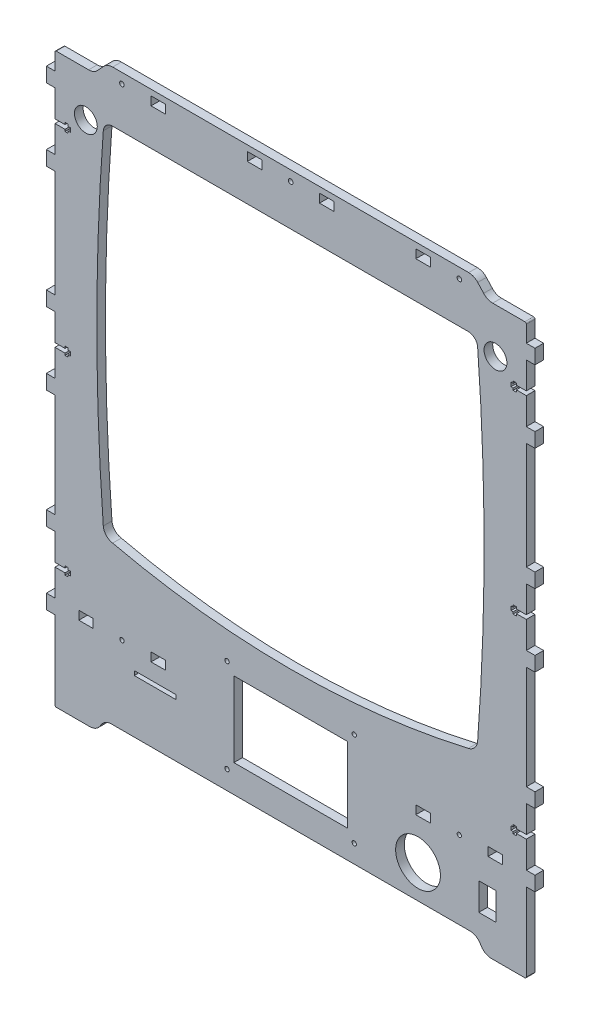
from build123d import *

# Parameters (mm, degrees)
SKETCH_1_R      = 1.5
SKETCH_1_R_2    = 15.5
SKETCH_1_R_3    = 1.6
SKETCH_1_R_4    = 7.9
SKETCH_1_W      = 10
SKETCH_1_H      = 6
SKETCH_1_W_2    = 78.6
SKETCH_1_H_2    = 51.99959895
SKETCH_1_W_3    = 12
SKETCH_1_H_3    = 19
SKETCH_1_W_4    = 29
SKETCH_1_H_4    = 3
EXTRUDE_2_DEPTH = 6


with BuildPart() as part:
    # Эскиз1 → Бобышка-Вытянуть2 (new body)
    with BuildSketch(Plane.XY):
        with BuildLine():
            Line((-162.349245127, -146.930877786), (-168.354558228, -146.930877786))
            Line((-168.354558228, -146.930877786), (-168.354558228, -136.930877786))
            Line((-168.354558228, -136.930877786), (-162.354558228, -136.930877786))
            Line((-162.354558228, -136.930877786), (-162.354558228, -118.320877786))
            Line((-162.354558228, -118.320877786), (-155.442615928, -118.320877786))
            Line((-155.442615928, -118.320877786), (-155.442615928, -119.72098181))
            Line((-155.442615928, -119.72098181), (-153.241793345, -119.72098181))
            Line((-153.241793345, -119.72098181), (-153.241793345, -118.321100605))
            Line((-153.241793345, -118.321100605), (-151.743644127, -118.321100605))
            Line((-151.743644127, -118.321100605), (-151.743644127, -115.521795283))
            Line((-151.743644127, -115.521795283), (-153.245115684, -115.521795283))
            Line((-153.245115684, -115.521795283), (-153.245115684, -114.120877786))
            Line((-153.245115684, -114.120877786), (-155.445116095, -114.120877786))
            Line((-155.445116095, -114.120877786), (-155.445116095, -115.520877786))
            Line((-155.445116095, -115.520877786), (-162.354558228, -115.520877786))
            Line((-162.354558228, -115.520877786), (-162.354558228, -96.940877786))
            Line((-162.354558228, -96.940877786), (-168.354558228, -96.940877786))
            Line((-168.354558228, -96.940877786), (-168.354558228, -86.940877786))
            Line((-168.354558228, -86.940877786), (-162.354558228, -86.940877786))
            Line((-162.354558228, -86.940877786), (-162.354558228, -15.210877786))
            Line((-162.354558228, -15.210877786), (-168.354558228, -15.210877786))
            Line((-168.354558228, -15.210877786), (-168.354558228, -5.210877786))
            Line((-168.354558228, -5.210877786), (-162.354558228, -5.210877786))
            Line((-162.354558228, -5.210877786), (-162.354558228, 13.389122214))
            Line((-162.354558228, 13.389122214), (-155.444055652, 13.389122214))
            Line((-155.444055652, 13.389122214), (-155.444055652, 11.989017706))
            Line((-155.444055652, 11.989017706), (-153.243233069, 11.989017706))
            Line((-153.243233069, 11.989017706), (-153.243233069, 13.362239479))
            Line((-153.243233069, 13.362239479), (-151.742761748, 13.362239479))
            Line((-151.742761748, 13.362239479), (-151.742761748, 16.188530845))
            Line((-151.742761748, 16.188530845), (-153.245115684, 16.188530845))
            Line((-153.245115684, 16.188530845), (-153.245115684, 17.589122214))
            Line((-153.245115684, 17.589122214), (-155.445116095, 17.589122214))
            Line((-155.445116095, 17.589122214), (-155.445116095, 16.189122214))
            Line((-155.445116095, 16.189122214), (-162.354558228, 16.189122214))
            Line((-162.354558228, 16.189122214), (-162.354558228, 34.789122214))
            Line((-162.354558228, 34.789122214), (-168.354558228, 34.789122214))
            Line((-168.354558228, 34.789122214), (-168.354558228, 44.789122214))
            Line((-168.354558228, 44.789122214), (-162.354558228, 44.789122214))
            Line((-162.354558228, 44.789122214), (-162.354558228, 118.949122214))
            Line((-162.354558228, 118.949122214), (-168.354558228, 118.949122214))
            Line((-168.354558228, 118.949122214), (-168.354558228, 128.949122214))
            Line((-168.354558228, 128.949122214), (-162.354558228, 128.949122214))
            Line((-162.354558228, 128.949122214), (-162.354558228, 147.549122214))
            Line((-162.354558228, 147.549122214), (-155.444087484, 147.549122214))
            Line((-155.444087484, 147.549122214), (-155.444087484, 146.149017702))
            Line((-155.444087484, 146.149017702), (-153.243264902, 146.149017702))
            Line((-153.243264902, 146.149017702), (-153.243264902, 147.548898907))
            Line((-153.243264902, 147.548898907), (-151.737469071, 147.548898907))
            Line((-151.737469071, 147.548898907), (-151.737951164, 150.348204717))
            Line((-151.737951164, 150.348204717), (-153.239802583, 150.348204717))
            Line((-153.239802583, 150.348204717), (-153.239802583, 151.749122214))
            Line((-153.239802583, 151.749122214), (-155.439802995, 151.749122214))
            Line((-155.439802995, 151.749122214), (-155.439802995, 150.349122214))
            Line((-155.439802995, 150.349122214), (-162.349245127, 150.349122214))
            Line((-162.349245127, 150.349122214), (-162.349245127, 168.949122214))
            Line((-162.349245127, 168.949122214), (-168.349245127, 168.949122214))
            Line((-168.349245127, 168.949122214), (-168.349245127, 178.949122214))
            Line((-168.349245127, 178.949122214), (-162.349245127, 178.949122214))
            Line((-162.349245127, 178.949122214), (-162.349245127, 190.349122214))
            ThreePointArc((-162.349245127, 190.349122214), (-162.144381362, 191.019766001), (-161.525304034, 191.349122214))
            Line((-161.525304034, 191.349122214), (-139.092392644, 191.349122214))
            ThreePointArc((-139.092392644, 191.349122214), (-135.666701236, 192.070006687), (-132.82207518, 194.110383773))
            Line((-132.82207518, 194.110383773), (-128.724185584, 198.587860655))
            ThreePointArc((-128.724185584, 198.587860655), (-125.879559527, 200.62823774), (-122.453868119, 201.349122214))
            Line((-122.453868119, 201.349122214), (123.955377865, 201.349122214))
            ThreePointArc((123.955377865, 201.349122214), (127.381069274, 200.62823774), (130.22569533, 198.587860655))
            Line((130.22569533, 198.587860655), (134.323584926, 194.110383773))
            ThreePointArc((134.323584926, 194.110383773), (137.168210982, 192.070006687), (140.59390239, 191.349122214))
            Line((140.59390239, 191.349122214), (162.850754873, 191.349122214))
            ThreePointArc((162.850754873, 191.349122214), (163.557861654, 191.056228995), (163.850754873, 190.349122214))
            Line((163.850754873, 190.349122214), (163.850754873, 178.949122214))
            Line((163.850754873, 178.949122214), (169.850754873, 178.949122214))
            Line((169.850754873, 178.949122214), (169.850754873, 168.949122214))
            Line((169.850754873, 168.949122214), (163.850754873, 168.949122214))
            Line((163.850754873, 168.949122214), (163.850754873, 150.349122214))
            Line((163.850754873, 150.349122214), (156.938753666, 150.349122214))
            Line((156.938753666, 150.349122214), (156.938753666, 151.74917383))
            Line((156.938753666, 151.74917383), (154.741012446, 151.74917383))
            Line((154.741012446, 151.74917383), (154.741012446, 150.349292624))
            Line((154.741012446, 150.349292624), (153.241012446, 150.349292624))
            Line((153.241012446, 150.349292624), (153.241012446, 147.550209336))
            Line((153.241012446, 147.550209336), (154.741012446, 147.550209336))
            Line((154.741012446, 147.550209336), (154.741012446, 146.149291839))
            Line((154.741012446, 146.149291839), (156.941736218, 146.149291839))
            Line((156.941736218, 146.149291839), (156.941736218, 147.549122214))
            Line((156.941736218, 147.549122214), (163.851237257, 147.549122214))
            Line((163.851237257, 147.549122214), (163.851237257, 128.949122214))
            Line((163.851237257, 128.949122214), (169.851237081, 128.949122214))
            Line((169.851237081, 128.949122214), (169.851237081, 118.949122214))
            Line((169.851237081, 118.949122214), (163.851237081, 118.949122214))
            Line((163.851237081, 118.949122214), (163.851237081, 44.789122214))
            Line((163.851237081, 44.789122214), (169.851237081, 44.789122214))
            Line((169.851237081, 44.789122214), (169.851237081, 34.789122214))
            Line((169.851237081, 34.789122214), (163.851237081, 34.789122214))
            Line((163.851237081, 34.789122214), (163.851237081, 16.189122214))
            Line((163.851237081, 16.189122214), (156.939202586, 16.189122214))
            Line((156.939202586, 16.189122214), (156.939202586, 17.562103605))
            Line((156.939202586, 17.562103605), (154.739101533, 17.562103605))
            Line((154.739101533, 17.562103605), (154.739101533, 16.189291862))
            Line((154.739101533, 16.189291862), (153.239956889, 16.189291862))
            Line((153.239956889, 16.189291862), (153.239956889, 13.39020884))
            Line((153.239956889, 13.39020884), (154.741461365, 13.39020884))
            Line((154.741461365, 13.39020884), (154.741461365, 11.989291851))
            Line((154.741461365, 11.989291851), (156.941702753, 11.989291851))
            Line((156.941702753, 11.989291851), (156.941702753, 13.389122214))
            Line((156.941702753, 13.389122214), (163.851237081, 13.389122214))
            Line((163.851237081, 13.389122214), (163.851237081, -5.210877786))
            Line((163.851237081, -5.210877786), (169.851237081, -5.210877786))
            Line((169.851237081, -5.210877786), (169.851237081, -15.210877786))
            Line((169.851237081, -15.210877786), (163.851237081, -15.210877786))
            Line((163.851237081, -15.210877786), (163.851237081, -86.940877786))
            Line((163.851237081, -86.940877786), (169.851237081, -86.940877786))
            Line((169.851237081, -86.940877786), (169.851237081, -96.940877786))
            Line((169.851237081, -96.940877786), (163.939237081, -96.940877786))
            Line((163.939237081, -96.940877786), (163.939237081, -115.520877786))
            Line((163.939237081, -115.520877786), (156.93923577, -115.520877786))
            Line((156.93923577, -115.520877786), (156.93923577, -114.122358317))
            Line((156.93923577, -114.122358317), (154.738205666, -114.122358317))
            Line((154.738205666, -114.122358317), (154.738205666, -115.522239523))
            Line((154.738205666, -115.522239523), (153.238413576, -115.522239523))
            Line((153.238413576, -115.522239523), (153.238413576, -118.322187164))
            Line((153.238413576, -118.322187164), (154.740539372, -118.322187164))
            Line((154.740539372, -118.322187164), (154.740539372, -119.723103854))
            Line((154.740539372, -119.723103854), (156.939923762, -119.723103854))
            Line((156.939923762, -119.723103854), (156.939923762, -118.320877786))
            Line((156.939923762, -118.320877786), (163.851344603, -118.320877786))
            Line((163.851344603, -118.320877786), (163.851344603, -136.930877786))
            Line((163.851344603, -136.930877786), (169.845441772, -136.930877786))
            Line((169.845441772, -136.930877786), (169.845441772, -146.930877786))
            Line((169.845441772, -146.930877786), (163.845441772, -146.930877786))
            Line((163.845441772, -146.930877786), (163.845441772, -200.973061911))
            ThreePointArc((163.845441772, -200.973061911), (163.501928515, -201.680136073), (162.762754873, -201.947675896))
            Line((162.762754873, -201.947675896), (139.726369967, -201.947675896))
            ThreePointArc((139.726369967, -201.947675896), (136.178541077, -201.14298723), (133.302992201, -198.914572468))
            Line((133.302992201, -198.914572468), (131.246288055, -195.894919373))
            ThreePointArc((131.246288055, -195.894919373), (128.327165513, -193.654997866), (124.734910288, -192.858614055))
            Line((124.734910288, -192.858614055), (-123.233400542, -192.858614055))
            ThreePointArc((-123.233400542, -192.858614055), (-126.825655767, -193.654997866), (-129.744778309, -195.894919373))
            Line((-129.744778309, -195.894919373), (-131.801482455, -198.914572469))
            ThreePointArc((-131.801482455, -198.914572469), (-134.720604996, -201.154493976), (-138.312860221, -201.950877786))
            Line((-138.312860221, -201.950877786), (-161.437304034, -201.950877786))
            ThreePointArc((-161.437304034, -201.950877786), (-162.093143033, -201.646865801), (-162.349245127, -200.970877786))
            Line((-162.349245127, -200.970877786), (-162.349245127, -146.930877786))
        make_face()
        with Locations((44.745441772, -115.136083352)):
            Circle(SKETCH_1_R, mode=Mode.SUBTRACT)
        with Locations((44.745441772, -180.385682302)):
            Circle(SKETCH_1_R, mode=Mode.SUBTRACT)
        with Locations((-43.254558228, -179.882480412)):
            Circle(SKETCH_1_R, mode=Mode.SUBTRACT)
        with Locations((-43.254558228, -115.136083352)):
            Circle(SKETCH_1_R, mode=Mode.SUBTRACT)
        with Locations((88.894233967, -169.827856004)):
            Circle(SKETCH_1_R_2, mode=Mode.SUBTRACT)
        with Locations((0.750754873, 194.349122214)):
            Circle(SKETCH_1_R_3, mode=Mode.SUBTRACT)
        with Locations((-116.049245127, 194.349122214)):
            Circle(SKETCH_1_R_3, mode=Mode.SUBTRACT)
        with Locations((117.550754873, 194.349122214)):
            Circle(SKETCH_1_R_3, mode=Mode.SUBTRACT)
        with Locations((-140.999245127, 160.349122214)):
            Circle(SKETCH_1_R_4, mode=Mode.SUBTRACT)
        with Locations((142.500754873, 160.349122214)):
            Circle(SKETCH_1_R_4, mode=Mode.SUBTRACT)
        with Locations((-115.994558228, -138.947675896)):
            Circle(SKETCH_1_R, mode=Mode.SUBTRACT)
        with Locations((117.485441772, -138.947675896)):
            Circle(SKETCH_1_R, mode=Mode.SUBTRACT)
        with Locations((-90.889245127, 194.349122214)):
            Rectangle(SKETCH_1_W, SKETCH_1_H, mode=Mode.SUBTRACT)
        with Locations((92.390754873, 194.349122214)):
            Rectangle(SKETCH_1_W, SKETCH_1_H, mode=Mode.SUBTRACT)
        with Locations((92.365441772, -138.947675896)):
            Rectangle(SKETCH_1_W, SKETCH_1_H, mode=Mode.SUBTRACT)
        with Locations((142.385441772, -138.947675896)):
            Rectangle(SKETCH_1_W, SKETCH_1_H, mode=Mode.SUBTRACT)
        with Locations((-140.894558228, -138.947675896)):
            Rectangle(SKETCH_1_W, SKETCH_1_H, mode=Mode.SUBTRACT)
        with Locations((-90.874558228, -138.947675896)):
            Rectangle(SKETCH_1_W, SKETCH_1_H, mode=Mode.SUBTRACT)
        with Locations((-24.239245127, 194.349122214)):
            Rectangle(SKETCH_1_W, SKETCH_1_H, mode=Mode.SUBTRACT)
        with Locations((25.740754873, 194.349122214)):
            Rectangle(SKETCH_1_W, SKETCH_1_H, mode=Mode.SUBTRACT)
        with BuildLine():
            Line((-122.399111136, 165.873018888), (123.624117201, 165.873018888))
            ThreePointArc((123.624117201, 165.873018888), (128.051771635, 164.15368067), (130.158760923, 159.896822223))
            ThreePointArc((130.158760923, 159.896822223), (134.629570514, 41.460685741), (130.125352868, -76.974184913))
            ThreePointArc((130.125352868, -76.974184913), (127.977308293, -81.497473491), (123.648924914, -84.015276578))
            ThreePointArc((123.648924914, -84.015276578), (0.588905308, -98.015276578), (-122.471114299, -84.015276578))
            ThreePointArc((-122.471114299, -84.015276578), (-126.930378694, -81.617835611), (-128.947210492, -76.974006197))
            ThreePointArc((-128.947210492, -76.974006197), (-133.43700353, 41.461656713), (-128.934108856, 159.896822224))
            ThreePointArc((-128.934108856, 159.896822224), (-126.846261851, 164.174875124), (-122.399111136, 165.873018888))
        make_face(mode=Mode.SUBTRACT)
        with Locations((0.745441772, -147.635882827)):
            Rectangle(SKETCH_1_W_2, SKETCH_1_H_2, mode=Mode.SUBTRACT)
        with Locations((136.938754873, -169.176180946)):
            Rectangle(SKETCH_1_W_3, SKETCH_1_H_3, mode=Mode.SUBTRACT)
        with Locations((-93.004246156, -154.427084063)):
            Rectangle(SKETCH_1_W_4, SKETCH_1_H_4, mode=Mode.SUBTRACT)
    extrude(amount=EXTRUDE_2_DEPTH)


solid = part.part
